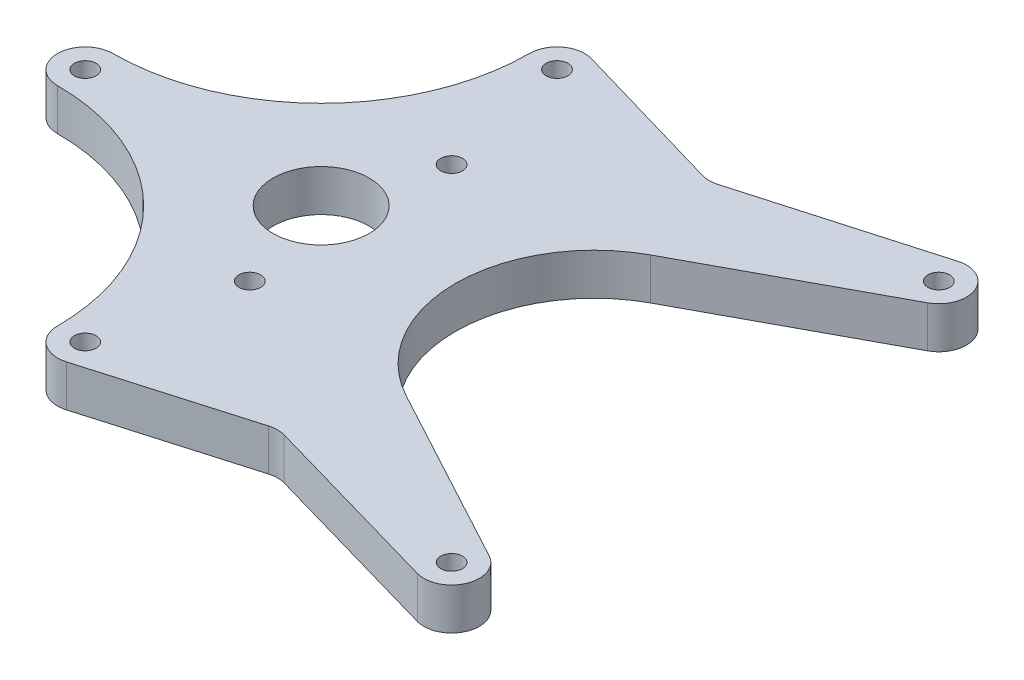
from build123d import *

# Parameters (mm, degrees)
SKETCH2_R           = 11
SKETCH2_R_2         = 2.4892
BOSS_EXTRUDE1_DEPTH = 4.7625


with BuildPart() as part:
    # Sketch2 → Boss-Extrude1 (new, symmetric)
    with BuildSketch(Plane(origin=(0, 0, 0), x_dir=(1, 0, 0), z_dir=(0, 1, 0))):
        with BuildLine():
            Line((37.640507705, 49.635900795), (1.774114238, 60.072132004))
            ThreePointArc((1.774114238, 60.072132004), (-3.811618724, 59.053785554), (-6.35, 53.975))
            ThreePointArc((-6.35, 53.975), (-20.299039546, 20.299039546), (-53.975, 6.35))
            ThreePointArc((-53.975, 6.35), (-60.325, 0), (-53.975, -6.35))
            ThreePointArc((-53.975, -6.35), (-20.299039546, -20.299039546), (-6.35, -53.975))
            ThreePointArc((-6.35, -53.975), (-3.811618724, -59.053785554), (1.774114238, -60.072132004))
            Line((1.774114238, -60.072132004), (37.640507705, -49.635900795))
            ThreePointArc((37.640507705, -49.635900795), (39.400339193, -49.383048862), (41.161290327, -49.627981648))
            Line((41.161290327, -49.627981648), (83.838709673, -61.83808395))
            ThreePointArc((83.838709673, -61.83808395), (91.466763895, -58.127150721), (88.599086108, -50.143751648))
            Line((88.599086108, -50.143751648), (47.431459746, -27.946405755))
            ThreePointArc((47.431459746, -27.946405755), (30.75, 0), (47.431459746, 27.946405755))
            Line((47.431459746, 27.946405755), (88.599086108, 50.143751648))
            ThreePointArc((88.599086108, 50.143751648), (91.466763895, 58.127150721), (83.838709673, 61.83808395))
            Line((83.838709673, 61.83808395), (41.161290327, 49.627981648))
            ThreePointArc((41.161290327, 49.627981648), (39.400339193, 49.383048862), (37.640507705, 49.635900795))
        make_face()
        Circle(SKETCH2_R, mode=Mode.SUBTRACT)
        with Locations((85.585378057, 55.733032799)):
            Circle(SKETCH2_R_2, mode=Mode.SUBTRACT)
        with Locations((85.585378057, -55.733032799)):
            Circle(SKETCH2_R_2, mode=Mode.SUBTRACT)
        with Locations((0, -53.975)):
            Circle(SKETCH2_R_2, mode=Mode.SUBTRACT)
        with Locations((-53.975, 0)):
            Circle(SKETCH2_R_2, mode=Mode.SUBTRACT)
        with Locations((0, 53.975)):
            Circle(SKETCH2_R_2, mode=Mode.SUBTRACT)
        with Locations((6.766967201, -23.085378057)):
            Circle(SKETCH2_R_2, mode=Mode.SUBTRACT)
        with Locations((6.766967201, 23.085378057)):
            Circle(SKETCH2_R_2, mode=Mode.SUBTRACT)
    extrude(amount=BOSS_EXTRUDE1_DEPTH, both=True)


solid = part.part
